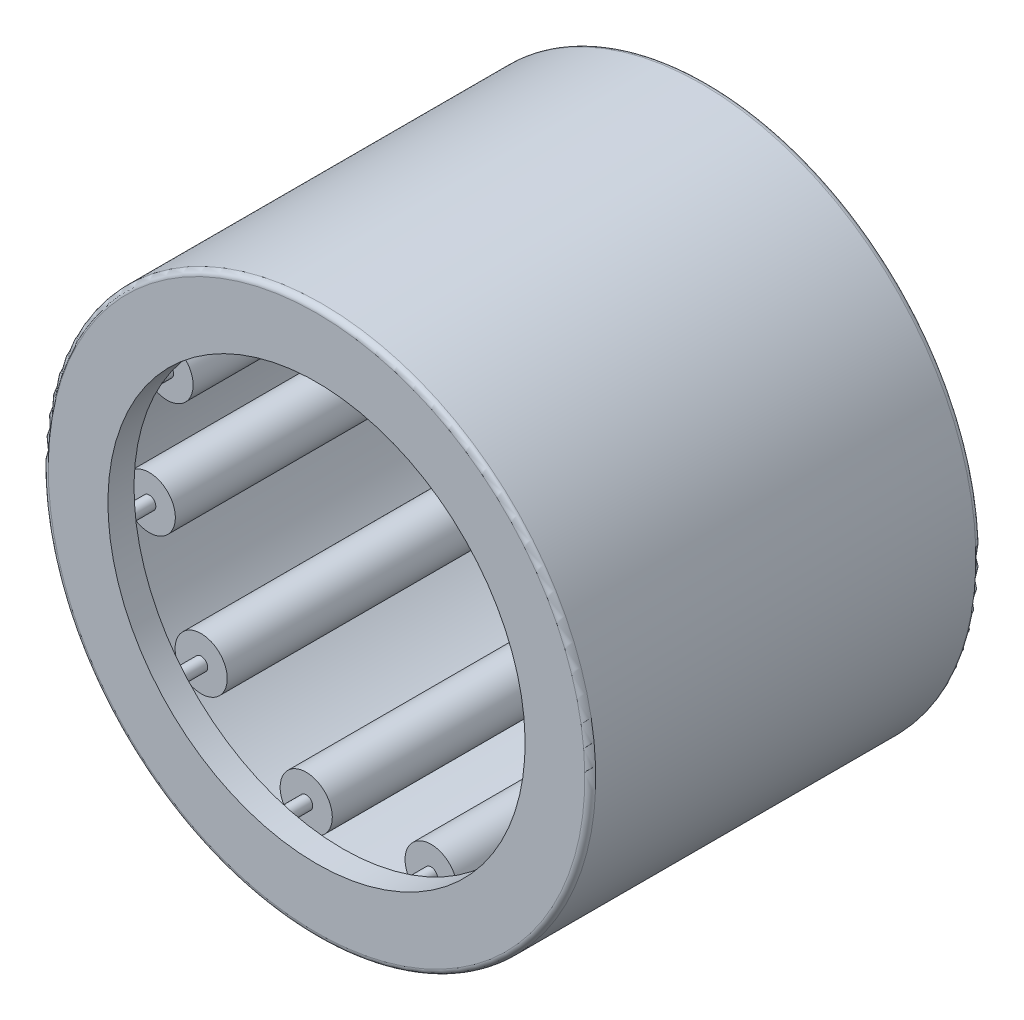
from build123d import *

# Parameters (mm, degrees)
SKETCH2_W         = 7.333333334
SKETCH2_H         = 0.5
SKETCH3_W         = 8.666666666
SKETCH3_H         = 0.166666666
CIRPATTERN1_COUNT = 11
CIRPATTERN1_ANGLE = 327.272727273
FILLET1_R         = 0.14


with BuildPart() as part:
    # Sketch7 → Revolve1 (revolve)
    with BuildSketch(Plane(origin=(0, 0, 0), x_dir=(0, 0, -1), z_dir=(1, 0, 0))):
        Polygon((-5, 7), (-5, 5.333333333), (-4.333333333, 5.333333333), (-4.333333333, 6.333333333), (4.333333333, 6.333333333), (4.333333333, 5.333333333), (5, 5.333333333), (5, 7), align=None)
    revolve(axis=Axis((0, 0, 5), (0, 0, -1)))

    # Fillet1
    fillet1_edges = [part.edges().sort_by_distance(p)[0] for p in [
        (0, -7, -5),
        (0, -7, 5),
    ]]
    fillet(fillet1_edges, radius=FILLET1_R)


with BuildPart() as body_2:
    # Sketch2 → Revolve2 (revolve)
    with BuildSketch(Plane(origin=(0, 0, 0), x_dir=(0, 0, -1), z_dir=(1, 0, 0))):
        with Locations((0, 6.083333333)):
            Rectangle(SKETCH2_W, SKETCH2_H)
    revolve(axis=Axis((0, 5.666666667, 3.666666667), (0, 0, -1)))


with BuildPart() as body_3:
    # Sketch3 → Revolve3 (revolve)
    with BuildSketch(Plane(origin=(0, 0, 0), x_dir=(0, 0, -1), z_dir=(1, 0, 0))):
        with Locations((0, 5.75)):
            Rectangle(SKETCH3_W, SKETCH3_H)
    revolve(axis=Axis((0, 5.666666667, 4.333333333), (0, 0, -1)))


with BuildPart() as cirpattern1_1:
    # CirPattern1: pattern copy
    add(body_2.part.rotate(Axis((0, 0, 5), (0, 0, -1)), 1 * CIRPATTERN1_ANGLE / (CIRPATTERN1_COUNT - 1)))


with BuildPart() as cirpattern1_2:
    # CirPattern1: pattern copy
    add(body_2.part.rotate(Axis((0, 0, 5), (0, 0, -1)), 2 * CIRPATTERN1_ANGLE / (CIRPATTERN1_COUNT - 1)))


with BuildPart() as cirpattern1_3:
    # CirPattern1: pattern copy
    add(body_2.part.rotate(Axis((0, 0, 5), (0, 0, -1)), 3 * CIRPATTERN1_ANGLE / (CIRPATTERN1_COUNT - 1)))


with BuildPart() as cirpattern1_4:
    # CirPattern1: pattern copy
    add(body_2.part.rotate(Axis((0, 0, 5), (0, 0, -1)), 4 * CIRPATTERN1_ANGLE / (CIRPATTERN1_COUNT - 1)))


with BuildPart() as cirpattern1_5:
    # CirPattern1: pattern copy
    add(body_2.part.rotate(Axis((0, 0, 5), (0, 0, -1)), 5 * CIRPATTERN1_ANGLE / (CIRPATTERN1_COUNT - 1)))


with BuildPart() as cirpattern1_6:
    # CirPattern1: pattern copy
    add(body_2.part.rotate(Axis((0, 0, 5), (0, 0, -1)), 6 * CIRPATTERN1_ANGLE / (CIRPATTERN1_COUNT - 1)))


with BuildPart() as cirpattern1_7:
    # CirPattern1: pattern copy
    add(body_2.part.rotate(Axis((0, 0, 5), (0, 0, -1)), 7 * CIRPATTERN1_ANGLE / (CIRPATTERN1_COUNT - 1)))


with BuildPart() as cirpattern1_8:
    # CirPattern1: pattern copy
    add(body_2.part.rotate(Axis((0, 0, 5), (0, 0, -1)), 8 * CIRPATTERN1_ANGLE / (CIRPATTERN1_COUNT - 1)))


with BuildPart() as cirpattern1_9:
    # CirPattern1: pattern copy
    add(body_2.part.rotate(Axis((0, 0, 5), (0, 0, -1)), 9 * CIRPATTERN1_ANGLE / (CIRPATTERN1_COUNT - 1)))


with BuildPart() as cirpattern1_10:
    # CirPattern1: pattern copy
    add(body_2.part.rotate(Axis((0, 0, 5), (0, 0, -1)), 10 * CIRPATTERN1_ANGLE / (CIRPATTERN1_COUNT - 1)))


with BuildPart() as cirpattern1_11:
    # CirPattern1: pattern copy
    add(body_3.part.rotate(Axis((0, 0, 5), (0, 0, -1)), 1 * CIRPATTERN1_ANGLE / (CIRPATTERN1_COUNT - 1)))


with BuildPart() as cirpattern1_12:
    # CirPattern1: pattern copy
    add(body_3.part.rotate(Axis((0, 0, 5), (0, 0, -1)), 2 * CIRPATTERN1_ANGLE / (CIRPATTERN1_COUNT - 1)))


with BuildPart() as cirpattern1_13:
    # CirPattern1: pattern copy
    add(body_3.part.rotate(Axis((0, 0, 5), (0, 0, -1)), 3 * CIRPATTERN1_ANGLE / (CIRPATTERN1_COUNT - 1)))


with BuildPart() as cirpattern1_14:
    # CirPattern1: pattern copy
    add(body_3.part.rotate(Axis((0, 0, 5), (0, 0, -1)), 4 * CIRPATTERN1_ANGLE / (CIRPATTERN1_COUNT - 1)))


with BuildPart() as cirpattern1_15:
    # CirPattern1: pattern copy
    add(body_3.part.rotate(Axis((0, 0, 5), (0, 0, -1)), 5 * CIRPATTERN1_ANGLE / (CIRPATTERN1_COUNT - 1)))


with BuildPart() as cirpattern1_16:
    # CirPattern1: pattern copy
    add(body_3.part.rotate(Axis((0, 0, 5), (0, 0, -1)), 6 * CIRPATTERN1_ANGLE / (CIRPATTERN1_COUNT - 1)))


with BuildPart() as cirpattern1_17:
    # CirPattern1: pattern copy
    add(body_3.part.rotate(Axis((0, 0, 5), (0, 0, -1)), 7 * CIRPATTERN1_ANGLE / (CIRPATTERN1_COUNT - 1)))


with BuildPart() as cirpattern1_18:
    # CirPattern1: pattern copy
    add(body_3.part.rotate(Axis((0, 0, 5), (0, 0, -1)), 8 * CIRPATTERN1_ANGLE / (CIRPATTERN1_COUNT - 1)))


with BuildPart() as cirpattern1_19:
    # CirPattern1: pattern copy
    add(body_3.part.rotate(Axis((0, 0, 5), (0, 0, -1)), 9 * CIRPATTERN1_ANGLE / (CIRPATTERN1_COUNT - 1)))


with BuildPart() as cirpattern1_20:
    # CirPattern1: pattern copy
    add(body_3.part.rotate(Axis((0, 0, 5), (0, 0, -1)), 10 * CIRPATTERN1_ANGLE / (CIRPATTERN1_COUNT - 1)))


solid = Compound([part.part, body_2.part, body_3.part, cirpattern1_1.part, cirpattern1_2.part, cirpattern1_3.part, cirpattern1_4.part, cirpattern1_5.part, cirpattern1_6.part, cirpattern1_7.part, cirpattern1_8.part, cirpattern1_9.part, cirpattern1_10.part, cirpattern1_11.part, cirpattern1_12.part, cirpattern1_13.part, cirpattern1_14.part, cirpattern1_15.part, cirpattern1_16.part, cirpattern1_17.part, cirpattern1_18.part, cirpattern1_19.part, cirpattern1_20.part])
